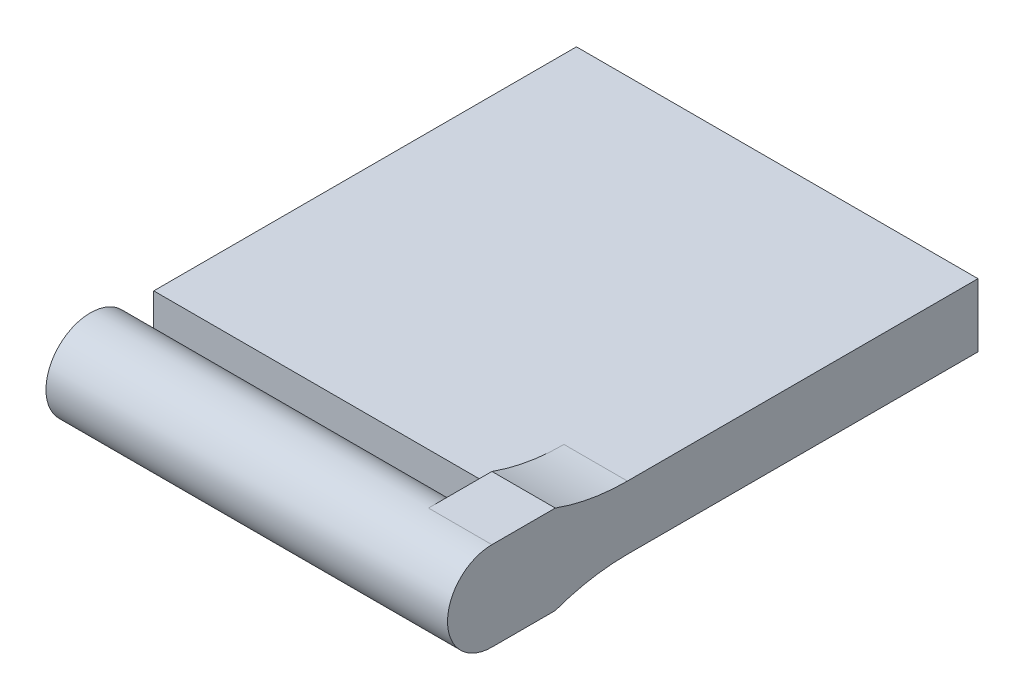
from build123d import *

# Parameters (mm, degrees)
SKETCH2_R           = 2.1
BOSS_EXTRUDE1_DEPTH = 16
SKETCH3_R           = 2.1
BOSS_EXTRUDE2_DEPTH = 3
BOSS_EXTRUDE3_REACH = 21.35
SKETCH4_W           = 20
SKETCH4_H           = 3
FILLET1_R           = 10


with BuildPart() as part:
    # Sketch2 → Boss-Extrude1 (new body)
    with BuildSketch(Plane(origin=(0, 0, 0), x_dir=(0, 0, -1), z_dir=(1, 0, 0))):
        Circle(SKETCH2_R)
    extrude(amount=BOSS_EXTRUDE1_DEPTH)

    # Sketch3 → Boss-Extrude2 (add)
    with BuildSketch(Plane(origin=(16, 0, 0), x_dir=(0, 0, -1), z_dir=(1, 0, 0))):
        with Locations(Location((0, 0, 0), (0, 0, 270))):
            Circle(SKETCH3_R)
        with BuildLine():
            Line((3, 2.1), (0, 2.1))
            ThreePointArc((0, 2.1), (1.48492424, 1.48492424), (2.1, 0))
            ThreePointArc((2.1, 0), (1.48492424, -1.48492424), (0, -2.1))
            Line((0, -2.1), (3, -2.1))
            Line((3, -2.1), (3, 2.1))
        make_face()
    extrude(amount=BOSS_EXTRUDE2_DEPTH)

    # Boss-Extrude3: up to this face of the body (flat: up to its plane)
    boss_extrude3_end = Plane(part.part.faces().sort_by_distance((0, 0, 0))[0])
    # Sketch4 → Boss-Extrude3 (add, up to the picked face)
    with BuildSketch(Plane(origin=(19, 0, 0), x_dir=(0, 0, -1), z_dir=(1, 0, 0)), mode=Mode.PRIVATE) as boss_extrude3_sk1:
        with Locations((13, 0)):
            Rectangle(SKETCH4_W, SKETCH4_H)
    boss_extrude3_tool1 = split(extrude(boss_extrude3_sk1.sketch, amount=-BOSS_EXTRUDE3_REACH, mode=Mode.PRIVATE), bisect_by=boss_extrude3_end, keep=Keep.BOTH, mode=Mode.PRIVATE)
    add(boss_extrude3_tool1.solids().sort_by(Axis((19, 0, -13), (-1, 0, 0)))[0])

    # Fillet1
    # the kernel refuses this fillet: 10 mm, written as the material it adds along each edge
    with BuildSketch(Plane(origin=(19, -1.5, -3), x_dir=(0, -1, 0), z_dir=(-1, 0, 0))) as fillet1_piece_1:
        with BuildLine():
            CenterArc((10, -3.411744422), FILLET1_R, 160.051556411, 19.948443589)
            Line((0, -3.411744422), (0, 0))
            Line((0, 0), (0.6, 0))
        make_face()
    extrude(amount=3)
    with BuildSketch(Plane(origin=(19, 1.5, -3), x_dir=(0, 1, 0), z_dir=(-1, 0, 0))) as fillet1_piece_2:
        with BuildLine():
            CenterArc((10, 3.411744422), FILLET1_R, 180, 19.948443589)
            Line((0, 3.411744422), (0, 0))
            Line((0, 0), (0.6, 0))
        make_face()
    extrude(amount=3)


solid = part.part
